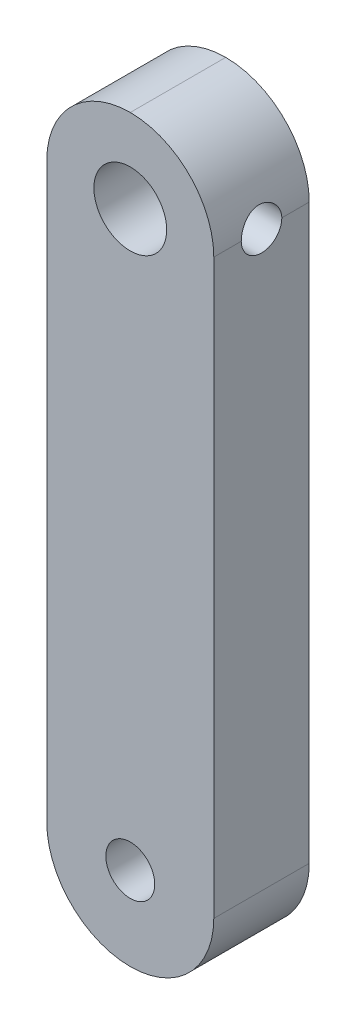
from build123d import *

# Parameters (mm, degrees)
ESQUISSE2_W                  = 14
ESQUISSE2_H                  = 62
BOSS_EXTRU_1_DEPTH           = 8
ENL_V_MAT_EXTRU_1_DEPTH      = 65.062469512
ENL_V_MAT_EXTRU_1_DEPTH_BACK = 65.062469512
ESQUISSE3_R                  = 3.05
ESQUISSE3_R_2                = 2.05
CONG_1_R                     = 7
ENL_V_MAT_EXTRU_2_REACH      = 66.062
ENL_V_MAT_EXTRU_2_END_RADIUS = 3.05
ESQUISSE4_R                  = 1.7


with BuildPart() as part:
    # Esquisse2 → Boss.-Extru.1 (new body)
    with BuildSketch(Plane.XY):
        with Locations((7, 31)):
            Rectangle(ESQUISSE2_W, ESQUISSE2_H)
    extrude(amount=BOSS_EXTRU_1_DEPTH)

    # Esquisse3 → Enlèv. mat.-Extru.1 (cut, two sides: drawn at the far end of the back side and taken through both)
    with BuildSketch(Plane.XY.offset(8).offset(-ENL_V_MAT_EXTRU_1_DEPTH_BACK)):
        with Locations((7, 55)):
            Circle(ESQUISSE3_R)
        with Locations(Location((7, 7, 0), (0, 0, 180))):
            Circle(ESQUISSE3_R_2)
    extrude(amount=ENL_V_MAT_EXTRU_1_DEPTH + ENL_V_MAT_EXTRU_1_DEPTH_BACK, mode=Mode.SUBTRACT)

    # Congé1
    cong_1_edges = [part.edges().sort_by_distance(p)[0] for p in [
        (14, 0, 4),
        (0, 0, 4),
        (0, 62, 4),
        (14, 62, 4),
    ]]
    fillet(cong_1_edges, radius=CONG_1_R - 0.0001)  # a hair under: the kernel refuses the full size

    # Enlèv. mat.-Extru.2: up to this cylinder (the profile starts outside it)
    enl_v_mat_extru_2_end = Plane(origin=(7, 55, 4), z_dir=(0, 0, 1)) * Cylinder(ENL_V_MAT_EXTRU_2_END_RADIUS, 139.224, mode=Mode.PRIVATE)
    # Esquisse4 → Enlèv. mat.-Extru.2 (cut, up to the surface)
    with BuildSketch(Plane(origin=(14, 0, 0), x_dir=(0, 0, -1), z_dir=(1, 0, 0)), mode=Mode.PRIVATE) as enl_v_mat_extru_2_sk1:
        with Locations((-4, 55)):
            Circle(ESQUISSE4_R)
    enl_v_mat_extru_2_tool1 = extrude(enl_v_mat_extru_2_sk1.sketch, amount=-ENL_V_MAT_EXTRU_2_REACH, mode=Mode.PRIVATE) - enl_v_mat_extru_2_end
    add(enl_v_mat_extru_2_tool1.solids().sort_by_distance((14, 55, 4))[0], mode=Mode.SUBTRACT)


solid = part.part
